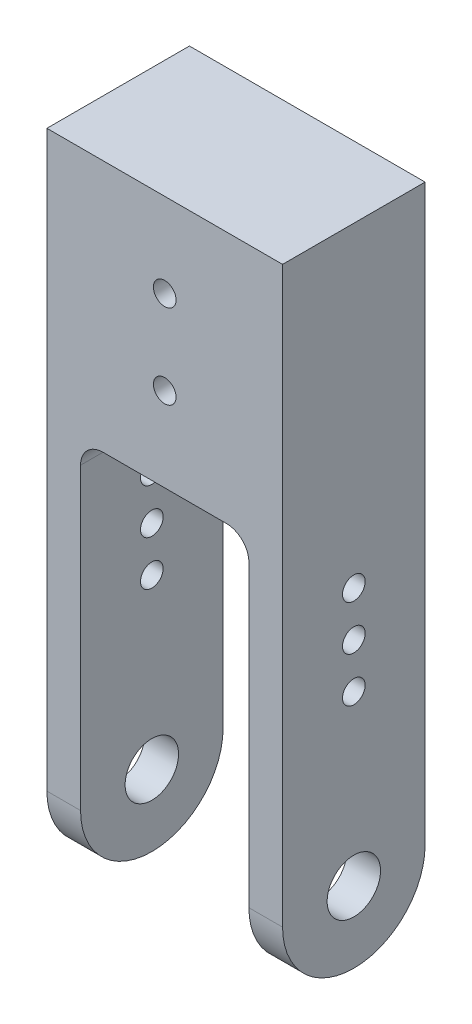
from build123d import *

# Parameters (mm, degrees)
SKETCH_1_W            = 42
SKETCH_1_H            = 25.4
EXTRUDE_1_DEPTH       = 70
SKETCH_5_W            = 6
SKETCH_5_H            = 25.4
EXTRUDE_5_DEPTH       = 70
SKETCH_6_R            = 4.7625
CUT_EXTRUDE_2_DEPTH   = 83.61531335
FILLET_6_R            = 4
HOLE_WIZARD_10_32_1_D = 4.0386
FILLET_7_R            = 12.7
SKETCH_9_W            = 42
SKETCH_9_H            = 25
CUT_EXTRUDE_3_DEPTH   = 78.370278531
HOLE_WIZARD_10_32_2_D = 4.0386


with BuildPart() as part:
    # 草圖1 → 填料-伸長1 (new body)
    with BuildSketch(Plane(origin=(0, 0, 0), x_dir=(1, 0, 0), z_dir=(0, 1, 0))):
        Rectangle(SKETCH_1_W, SKETCH_1_H)
    extrude(amount=EXTRUDE_1_DEPTH)

    # 草圖5 → 填料-伸長5 (add)
    with BuildSketch(Plane.XZ):
        with Locations((-18, 0)):
            Rectangle(SKETCH_5_W, SKETCH_5_H)
        with Locations((18, 0)):
            Rectangle(SKETCH_5_W, SKETCH_5_H)
    extrude(amount=EXTRUDE_5_DEPTH)

    # 草圖6 → 除料-伸長2 (cut, through all)
    with BuildSketch(Plane.ZY.offset(21)):
        with Locations((0, -57.3)):
            Circle(SKETCH_6_R)
    extrude(amount=-CUT_EXTRUDE_2_DEPTH, mode=Mode.SUBTRACT)

    # 圓角6
    fillet_6_edges = [part.edges().sort_by_distance(p)[0] for p in [
        (15, 0, 0),
        (-15, 0, 0),
    ]]
    fillet(fillet_6_edges, radius=FILLET_6_R)

    # #10-32 螺紋孔1 (through all)
    with Locations(Plane.XY.offset(12.7)):
        with Locations((0, 30), (0, 15)):
            Hole(HOLE_WIZARD_10_32_1_D / 2)

    # 圓角7
    fillet_7_edges = [part.edges().sort_by_distance(p)[0] for p in [
        (18, -70, 12.7),
        (18, -70, -12.7),
        (-18, -70, 12.7),
        (-18, -70, -12.7),
    ]]
    fillet(fillet_7_edges, radius=FILLET_7_R - 0.0001)  # a hair under: the kernel refuses the full size

    # 草圖9 → 除料-伸長3 (cut, through all)
    with BuildSketch(Plane.XY.offset(12.7)):
        with Locations((0, 57.5)):
            Rectangle(SKETCH_9_W, SKETCH_9_H)
    extrude(amount=-CUT_EXTRUDE_3_DEPTH, mode=Mode.SUBTRACT)

    # #10-32 螺紋孔2 (through all)
    with Locations(Plane(origin=(21, 0, 0), x_dir=(0, 0, -1), z_dir=(1, 0, 0))):
        with Locations((0, -11.3), (0, -19.3), (0, -27.3)):
            Hole(HOLE_WIZARD_10_32_2_D / 2)


solid = part.part
